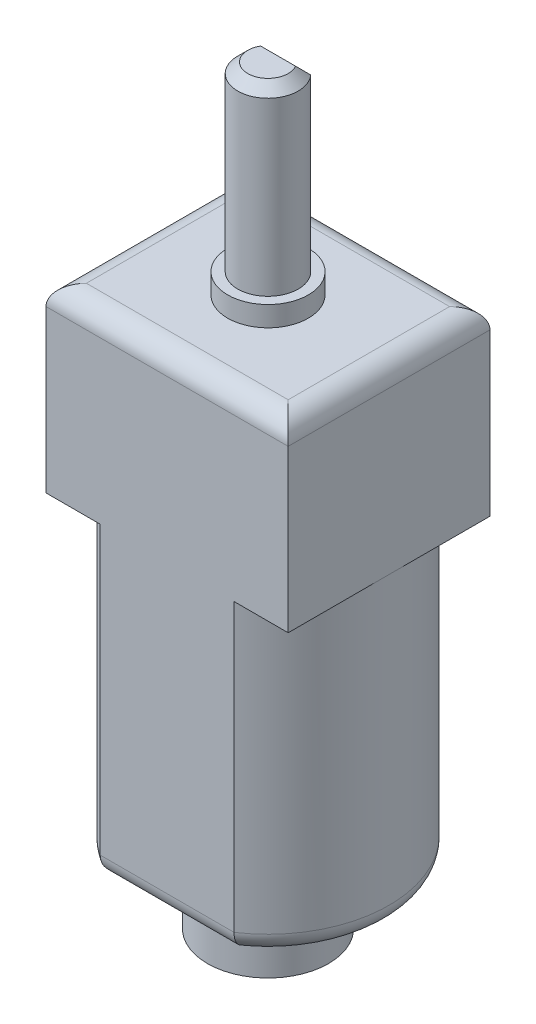
from build123d import *

# Parameters (mm, degrees)
EXTRUDE_2_DEPTH     = 15.2
SKETCH_4_W          = 12
SKETCH_4_H          = 10
EXTRUDE_3_DEPTH     = 9
SKETCH_5_R          = 2
EXTRUDE_4_DEPTH     = 1
SKETCH_6_R          = 1.5
EXTRUDE_5_DEPTH     = 9
CUT_EXTRUDE_START   = -8
CUT_EXTRUDE_2_DEPTH = 8
CHAMFER_1_SIZE      = 0.5
FILLET_1_R          = 1
SKETCH_8_R          = 3
EXTRUDE_6_DEPTH     = 3


with BuildPart() as part:
    # Эскиз3 → Бобышка-Вытянуть2 (new body)
    with BuildSketch(Plane(origin=(0, 0, 0), x_dir=(1, 0, 0), z_dir=(0, 1, 0))):
        with BuildLine():
            Line((-3.31662479, -5), (3.31662479, -5))
            ThreePointArc((3.31662479, -5), (6, 0), (3.31662479, 5))
            Line((3.31662479, 5), (-3.31662479, 5))
            ThreePointArc((-3.31662479, 5), (-6, 0), (-3.31662479, -5))
        make_face()
    extrude(amount=EXTRUDE_2_DEPTH)

    # Эскиз4 → Бобышка-Вытянуть3 (add)
    with BuildSketch(Plane(origin=(0, 15.2, 0), x_dir=(1, 0, 0), z_dir=(0, 1, 0))):
        Rectangle(SKETCH_4_W, SKETCH_4_H)
    extrude(amount=EXTRUDE_3_DEPTH)

    # Эскиз5 → Бобышка-Вытянуть4 (add)
    with BuildSketch(Plane(origin=(0, 24.2, 0), x_dir=(1, 0, 0), z_dir=(0, 1, 0))):
        with Locations(Location((0, 0, 0), (0, 0, 270))):
            Circle(SKETCH_5_R)
    extrude(amount=EXTRUDE_4_DEPTH)

    # Эскиз6 → Бобышка-Вытянуть5 (add)
    with BuildSketch(Plane(origin=(0, 25.2, 0), x_dir=(1, 0, 0), z_dir=(0, 1, 0))):
        with Locations(Location((0, 0, 0), (0, 0, 270))):
            Circle(SKETCH_6_R)
    extrude(amount=EXTRUDE_5_DEPTH)

    # Эскиз7 → Вырез-Вытянуть2 (cut)
    with BuildSketch(Plane(origin=(0, 34.2, 0), x_dir=(1, 0, 0), z_dir=(0, 1, 0)).offset(CUT_EXTRUDE_START)):
        with BuildLine():
            Line((-1.118033989, 1), (1.118033989, 1))
            ThreePointArc((1.118033989, 1), (0, 1.5), (-1.118033989, 1))
        make_face()
    extrude(amount=CUT_EXTRUDE_2_DEPTH, mode=Mode.SUBTRACT)

    # Фаска1
    chamfer_1_edges = [part.edges().sort_by_distance(p)[0] for p in [
        (-1.369306394, 34.2, 0.612372436),
        (0, 34.2, -1),
    ]]
    chamfer(chamfer_1_edges, length=CHAMFER_1_SIZE - 0.0001)  # a hair under: the kernel refuses the full size

    # Скругление1
    fillet_1_edges = [part.edges().sort_by_distance(p)[0] for p in [
        (-6, 24.2, 0),
        (0, 24.2, 5),
        (6, 24.2, 0),
        (0, 24.2, -5),
        (0, 0, -5),
        (6, 0, 0),
        (0, 0, 5),
        (-6, 0, 0),
    ]]
    fillet(fillet_1_edges, radius=FILLET_1_R - 0.0001)  # a hair under: the kernel refuses the full size

    # Эскиз8 → Бобышка-Вытянуть6 (add)
    with BuildSketch(Plane.XZ):
        with Locations(Location((0, 0, 0), (0, 0, 90))):
            Circle(SKETCH_8_R)
    extrude(amount=EXTRUDE_6_DEPTH)


solid = part.part
